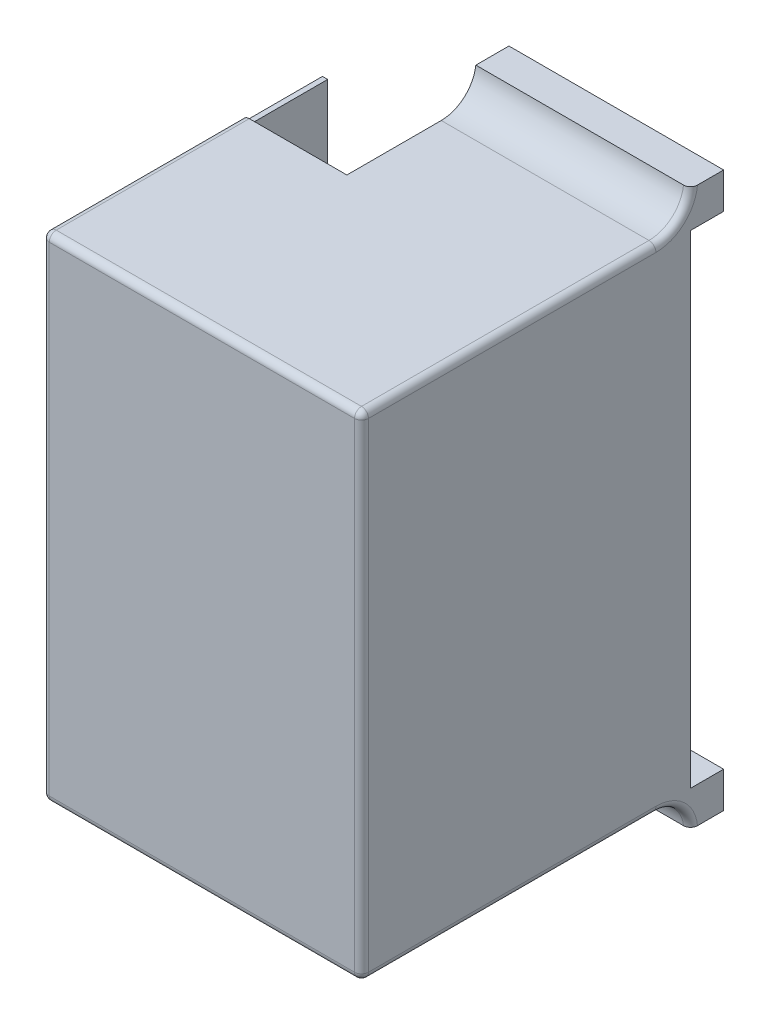
from build123d import *

# Parameters (mm, degrees)
SKETCH1_W             = 141.6
SKETCH1_H             = 94.4
BOSS_EXTRUDE1_DEPTH   = 91.6
SHELL1_T              = -1.5
SKETCH2_W             = 141.6
SKETCH2_H             = 14
CUT_EXTRUDE1_DEPTH    = 2
SKETCH3_W             = 30
SKETCH3_H             = 37
CUT_EXTRUDE2_DEPTH    = 2
SKETCH4_W             = 91.6
SKETCH4_H             = 8.8
BOSS_EXTRUDE2_DEPTH   = 9.5
SKETCH4_W_2           = 61.6
BOSS_EXTRUDE2_2_DEPTH = 9.5
SKETCH5_W             = 91.6
SKETCH5_H             = 1.5
SKETCH5_W_2           = 61.6
BOSS_EXTRUDE3_DEPTH   = 9.5
FILLET1_R             = 10
SKETCH6_W             = 2
SKETCH6_H             = 10.3
CUT_EXTRUDE3_DEPTH    = 200.80510504
FILLET2_R             = 2


with BuildPart() as part:
    # Sketch1 → Boss-Extrude1 (new body)
    with BuildSketch(Plane.YZ):
        with Locations((70.8, 47.2)):
            Rectangle(SKETCH1_W, SKETCH1_H)
    extrude(amount=BOSS_EXTRUDE1_DEPTH)

    # Shell1
    shell1_openings = [part.faces().sort_by_distance(p)[0] for p in [
        (45.8, 70.8, 0),
    ]]
    offset(amount=SHELL1_T, openings=shell1_openings, kind=Kind.INTERSECTION)

    # Sketch2 → Cut-Extrude1 (cut)
    with BuildSketch(Plane(origin=(0, 0, 0), x_dir=(0, -1, 0), z_dir=(-1, 0, 0))):
        with Locations((-70.8, 7)):
            Rectangle(SKETCH2_W, SKETCH2_H)
    extrude(amount=-CUT_EXTRUDE1_DEPTH, mode=Mode.SUBTRACT)

    # Sketch3 → Cut-Extrude2 (cut)
    with BuildSketch(Plane(origin=(0, 141.6, 0), x_dir=(1, 0, 0), z_dir=(0, 1, 0))):
        with Locations((15, -18.5)):
            Rectangle(SKETCH3_W, SKETCH3_H)
    extrude(amount=-CUT_EXTRUDE2_DEPTH, mode=Mode.SUBTRACT)



with BuildPart() as body_2:
    # Sketch4 → Boss-Extrude2 (new body)
    with BuildSketch(Plane(origin=(0, 0, 0), x_dir=(1, 0, 0), z_dir=(0, 0, -1))):
        with Locations((45.8, 4.4)):
            Rectangle(SKETCH4_W, SKETCH4_H)
    extrude(amount=BOSS_EXTRUDE2_DEPTH)


with BuildPart() as body_3:
    # Sketch4 → Boss-Extrude2 2 (new body)
    with BuildSketch(Plane(origin=(0, 0, 0), x_dir=(1, 0, 0), z_dir=(0, 0, -1))):
        with Locations((60.8, -146)):
            Rectangle(SKETCH4_W_2, SKETCH4_H)
    extrude(amount=BOSS_EXTRUDE2_2_DEPTH)


with BuildPart() as part_1:
    add(part.part)

    add(body_2.part)  # Boss-Extrude3 merges body 2

    add(body_3.part)  # Boss-Extrude3 merges body 3
    # Sketch5 → Boss-Extrude3 (add)
    with BuildSketch(Plane(origin=(0, 0, 0), x_dir=(1, 0, 0), z_dir=(0, 0, -1))):
        with Locations((45.8, -0.75)):
            Rectangle(SKETCH5_W, SKETCH5_H)
        with Locations((60.8, -140.85)):
            Rectangle(SKETCH5_W_2, SKETCH5_H)
    extrude(amount=BOSS_EXTRUDE3_DEPTH)

    # Fillet1
    # the kernel refuses this fillet: 10 mm, written as the material it adds along each edge
    with BuildSketch(Plane(origin=(91.6, 0, 0), x_dir=(0, 0, 1), z_dir=(-1, 0, 0))) as fillet1_piece_1:
        with BuildLine():
            CenterArc((9.927738917, -10), FILLET1_R, 90, 83.107897421)
            Line((0, -8.8), (-0.198554778, -8.776))
            ThreePointArc((-0.198554778, -8.776), (-0.2, -4.4), (-0.2, 0))
            Line((-0.2, 0), (0, 0.2))
            Line((0, 0.2), (9.927738917, 0.2))
            Line((9.927738917, 0.2), (9.927738917, 0))
        make_face()
    extrude(amount=89.6)
    with BuildSketch(Plane(origin=(91.6, 141.6, 0), x_dir=(0, 0, 1), z_dir=(-1, 0, 0))) as fillet1_piece_2:
        with BuildLine():
            CenterArc((9.927738917, 10), FILLET1_R, 186.892102579, 83.107897421)
            Line((0, 8.8), (-0.198554778, 8.776))
            ThreePointArc((-0.198554778, 8.776), (-0.2, 4.4), (-0.2, 0))
            Line((-0.2, 0), (0, -0.2))
            Line((0, -0.2), (9.927738917, -0.2))
            Line((9.927738917, -0.2), (9.927738917, 0))
        make_face()
    extrude(amount=61.6)

    # Sketch6 → Cut-Extrude3 (cut, through all)
    with BuildSketch(Plane.XY):
        with Locations((1, -3.65)):
            Rectangle(SKETCH6_W, SKETCH6_H)
    extrude(amount=-CUT_EXTRUDE3_DEPTH, mode=Mode.SUBTRACT)

    # Fillet2
    fillet2_edges = [part_1.edges().sort_by_distance(p)[0] for p in [
        (91.6, 144.116685226, 3.294489336),
        (91.6, -2.516685226, 3.294489336),
        (0, 0, 54.2),
        (0, 141.6, 65.7),
        (91.6, 141.6, 52.163869458),
        (91.6, 0, 52.163869458),
        (0, 70.8, 94.4),
        (45.8, 0, 94.4),
        (91.6, 70.8, 94.4),
        (45.8, 141.6, 94.4),
    ]]
    fillet(fillet2_edges, radius=FILLET2_R)


solid = part_1.part
